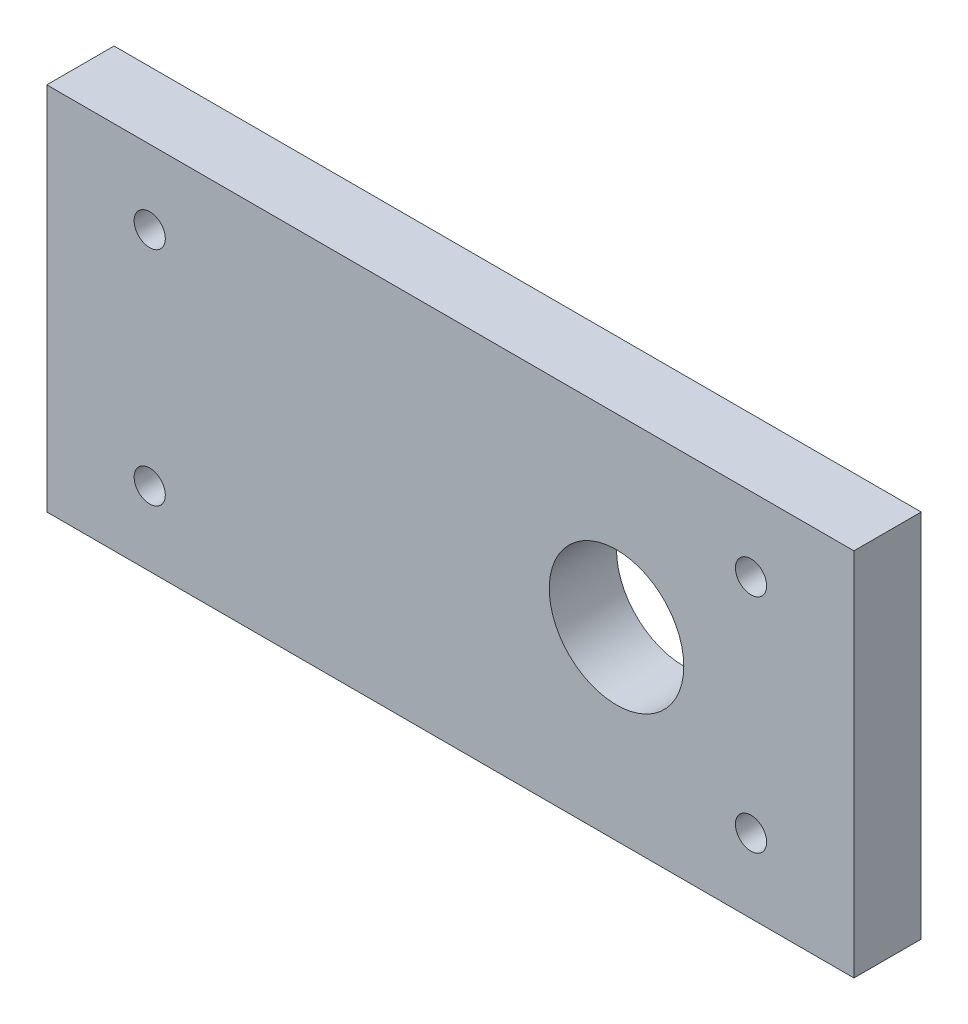
from build123d import *

# Parameters (mm, degrees)
SKETCH1_W               = 76.2
SKETCH1_H               = 34.925
BOSS_EXTRUDE1_DEPTH     = 6.35
ADVANCEDHOLE1_OUTLINE_R = 1.4732
ADVANCEDHOLE1_DEPTH     = 6.35
CUT_EXTRUDE1_REACH      = 44.39
SKETCH5_R               = 6.35


# Read off the part's stored shape, not the designer's step: AdvancedHole1
with BuildPart() as part:
    # Sketch1 → Boss-Extrude1 (new body)
    with BuildSketch(Plane.XY):
        Rectangle(SKETCH1_W, SKETCH1_H)
    extrude(amount=BOSS_EXTRUDE1_DEPTH)

    # AdvancedHole1 outline → AdvancedHole1 (cut)
    with BuildSketch(Plane.XY):
        with Locations((28.3845, 10.4775)):
            Circle(ADVANCEDHOLE1_OUTLINE_R)
        with Locations((28.3845, -10.4775)):
            Circle(ADVANCEDHOLE1_OUTLINE_R)
        with Locations((-28.3845, -10.4775)):
            Circle(ADVANCEDHOLE1_OUTLINE_R)
        with Locations((-28.3845, 10.4775)):
            Circle(ADVANCEDHOLE1_OUTLINE_R)
    extrude(amount=ADVANCEDHOLE1_DEPTH, mode=Mode.SUBTRACT)

    # Sketch5 → Cut-Extrude1 (cut, up to next)
    with BuildSketch(Plane.XY.offset(6.35), mode=Mode.PRIVATE) as cut_extrude1_sk1:
        with Locations((15.6845, 0)):
            Circle(SKETCH5_R)
    cut_extrude1_tool1 = extrude(cut_extrude1_sk1.sketch, amount=-CUT_EXTRUDE1_REACH, mode=Mode.PRIVATE) & part.part
    add(cut_extrude1_tool1.solids().sort_by_distance((15.6845, 0, 6.35))[0], mode=Mode.SUBTRACT)


solid = part.part
